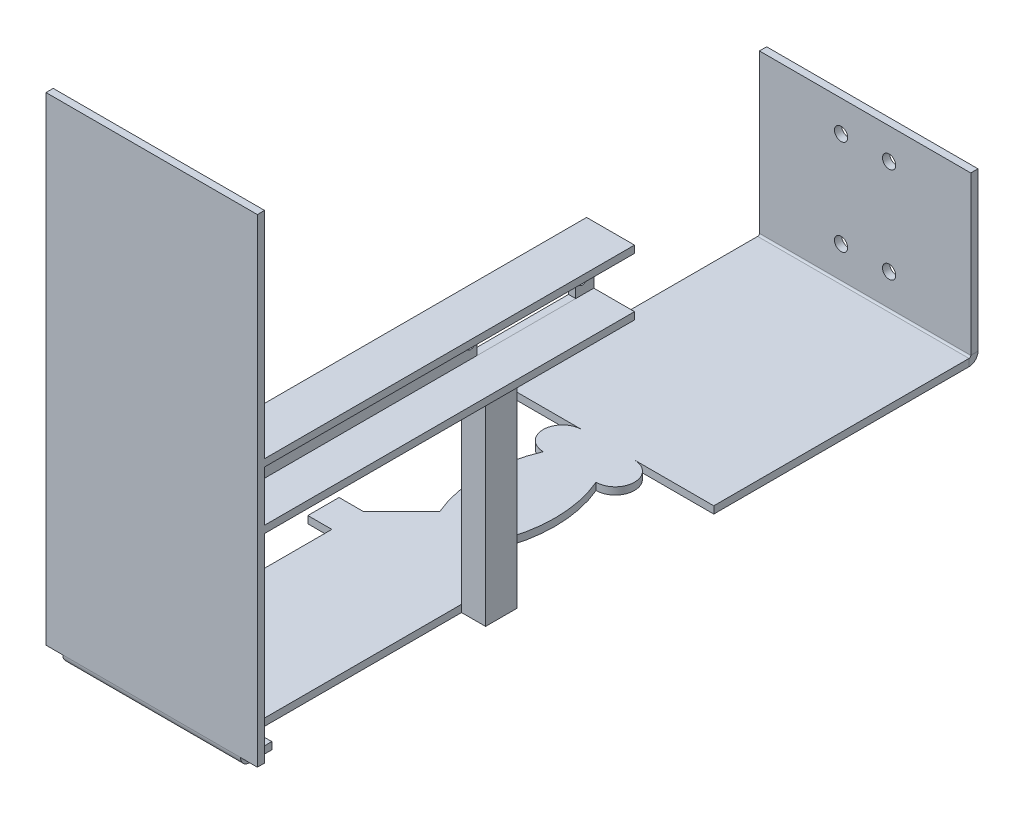
from build123d import *

# Parameters (mm, degrees)
BASE_FLANGE1_START                    = -3
BASE_FLANGE1_OUTLINE_W                = 88
BASE_FLANGE1_OUTLINE_H                = 300
BASE_FLANGE1_DEPTH                    = 3
CUT_EXTRUDE2_DEPTH                    = 509.426019398
CUT_EXTRUDE2_DEPTH_BACK               = 3
SKETCH14_OUTSIDE_W                    = 152.53
SKETCH14_OUTSIDE_H                    = 364.53
T_LE_PLI_E_SUR_AR_TE2_STRIP_W         = 13.4732
T_LE_PLI_E_SUR_AR_TE2_STRIP_H         = 3
T_LE_PLI_E_SUR_AR_TE2_STRIP_CUT_DEPTH = 88
T_LE_PLI_E_SUR_AR_TE2_DEPTH           = 88
D_GAGEMENT_M51_D                      = 5.5
T_LE_PLI_E_SUR_AR_TE3_STRIP_W         = 13.4732
T_LE_PLI_E_SUR_AR_TE3_STRIP_H         = 3
T_LE_PLI_E_SUR_AR_TE3_STRIP_CUT_DEPTH = 74
T_LE_PLI_E_SUR_AR_TE3_DEPTH           = 74
T_LE_PLI_E_SUR_AR_TE3_PROFILE_W       = 88
T_LE_PLI_E_SUR_AR_TE3_PROFILE_H       = 199.2634
T_LE_PLI_E_SUR_AR_TE3_FLAT_DEPTH      = 3
BOSS_EXTRUDE2_DEPTH                   = 154
CUT_EXTRUDE3_REACH                    = 544.8
SKETCH48_W                            = 41
SKETCH48_H                            = 21
BOSS_EXTRUDE3_REACH                   = 548.341
CUT_EXTRUDE4_REACH                    = 544.8
SKETCH50_R                            = 2


# Read off the part's stored shape, not the designer's step: Base-Flange1
# Sheet-metal steps are written as plain solids
with BuildPart() as part:
    # Base-Flange1 outline → Base-Flange1 (new body)
    with BuildSketch(Plane(origin=(0, 0, 0), x_dir=(1, 0, 0), z_dir=(0, 1, 0)).offset(BASE_FLANGE1_START)):
        with Locations((48.130435799, 350)):
            Rectangle(BASE_FLANGE1_OUTLINE_W, BASE_FLANGE1_OUTLINE_H)
    extrude(amount=BASE_FLANGE1_DEPTH)

    # Sketch14 outside → Cut-Extrude2 (cut, two sides: drawn at the far end of the back side and taken through both)
    with BuildSketch(Plane.XZ.offset(3).offset(-CUT_EXTRUDE2_DEPTH_BACK)):
        with Locations((48.13, -350)):
            Rectangle(SKETCH14_OUTSIDE_W, SKETCH14_OUTSIDE_H)
        with BuildLine():
            Line((85.130435799, -200), (11.130435799, -200))
            Line((11.130435799, -200), (11.130435799, -213))
            Line((11.130435799, -213), (21.130435799, -213))
            Line((21.130435799, -213), (21.130435799, -302))
            Line((21.130435799, -302), (11.130435799, -302))
            Line((11.130435799, -302), (11.130435799, -315))
            Line((11.130435799, -315), (21.130435799, -315))
            Line((21.130435799, -315), (37.130435799, -331))
            ThreePointArc((37.130435799, -331), (32.754046891, -352.5), (37.130435799, -374))
            ThreePointArc((37.130435799, -374), (29.130435799, -382), (37.130435799, -390))
            Line((37.130435799, -390), (4.130435799, -390))
            Line((4.130435799, -390), (4.130435799, -500))
            Line((4.130435799, -500), (92.130435799, -500))
            Line((92.130435799, -500), (92.130435799, -390))
            Line((92.130435799, -390), (59.130435799, -390))
            ThreePointArc((59.130435799, -390), (67.130435799, -382), (59.130435799, -374))
            ThreePointArc((59.130435799, -374), (63.506824707, -352.5), (59.130435799, -331))
            Line((59.130435799, -331), (75.130435799, -315))
            Line((75.130435799, -315), (85.130435799, -315))
            Line((85.130435799, -315), (85.130435799, -302))
            Line((85.130435799, -302), (75.130435799, -302))
            Line((75.130435799, -302), (75.130435799, -213))
            Line((75.130435799, -213), (85.130435799, -213))
            Line((85.130435799, -213), (85.130435799, -200))
        make_face(mode=Mode.SUBTRACT)
    extrude(amount=CUT_EXTRUDE2_DEPTH + CUT_EXTRUDE2_DEPTH_BACK, mode=Mode.SUBTRACT)

    # Tôle pliée sur arête2 strip (across the edge) → Tôle pliée sur arête2 strip cut (cut)
    with BuildSketch(Plane(origin=(92.130435799, 0, -500), x_dir=(0, 0, 1), z_dir=(-1, 0, 0))):
        with Locations((-3, -1.5)):
            Rectangle(T_LE_PLI_E_SUR_AR_TE2_STRIP_W, T_LE_PLI_E_SUR_AR_TE2_STRIP_H)
    extrude(amount=T_LE_PLI_E_SUR_AR_TE2_STRIP_CUT_DEPTH, mode=Mode.SUBTRACT)

    # Tôle pliée sur arête2 section (across the edge) → Tôle pliée sur arête2 (add)
    with BuildSketch(Plane(origin=(92.130435799, 0, -500), x_dir=(0, 0, 1), z_dir=(-1, 0, 0))):
        with BuildLine():
            Line((0, 0.7366), (0, 66.5))
            Line((0, 66.5), (3, 66.5))
            Line((3, 66.5), (3, 0.7366))
            ThreePointArc((3, 0.7366), (3.215745145, 0.215745145), (3.7366, 0))
            Line((3.7366, 0), (3.7366, -3))
            ThreePointArc((3.7366, -3), (1.094424801, -1.905575199), (0, 0.7366))
        make_face()
    extrude(amount=T_LE_PLI_E_SUR_AR_TE2_DEPTH)

    # Dégagement M51 (through all)
    with Locations(Plane(origin=(58.130435799, 53.6, -500), x_dir=(-1, 0, 0), z_dir=(0, 0, -1))):
        with Locations((0, 0), (20, 0), (0, -39.7), (20, -39.7)):
            Hole(D_GAGEMENT_M51_D / 2)

    # Tôle pliée sur arête3 strip (across the edge) → Tôle pliée sur arête3 strip cut (cut)
    with BuildSketch(Plane(origin=(11.130435799, 0, -200), x_dir=(0, 0, -1), z_dir=(1, 0, 0))):
        with Locations((-3, -1.5)):
            Rectangle(T_LE_PLI_E_SUR_AR_TE3_STRIP_W, T_LE_PLI_E_SUR_AR_TE3_STRIP_H)
    extrude(amount=T_LE_PLI_E_SUR_AR_TE3_STRIP_CUT_DEPTH, mode=Mode.SUBTRACT)

    # Tôle pliée sur arête3 bend section (across the edge) → Tôle pliée sur arête3 (add)
    with BuildSketch(Plane(origin=(11.130435799, 0, -200), x_dir=(0, 0, -1), z_dir=(1, 0, 0))):
        with BuildLine():
            Line((0, 0.7366), (3, 0.7366))
            ThreePointArc((3, 0.7366), (3.215745145, 0.215745145), (3.7366, 0))
            Line((3.7366, 0), (3.7366, -3))
            ThreePointArc((3.7366, -3), (1.094424801, -1.905575199), (0, 0.7366))
        make_face()
    extrude(amount=T_LE_PLI_E_SUR_AR_TE3_DEPTH)

    # Tôle pliée sur arête3 profile (on flange) → Tôle pliée sur arête3 flat (add)
    with BuildSketch(Plane(origin=(0, 0, -200), x_dir=(-1, 0, 0), z_dir=(0, 0, -1))):
        with Locations((-48.130435799, 100.3683)):
            Rectangle(T_LE_PLI_E_SUR_AR_TE3_PROFILE_W, T_LE_PLI_E_SUR_AR_TE3_PROFILE_H)
    extrude(amount=T_LE_PLI_E_SUR_AR_TE3_FLAT_DEPTH)

    # Sketch47 → Boss-Extrude2 (add)
    with BuildSketch(Plane(origin=(0, 0, -203), x_dir=(-1, 0, 0), z_dir=(0, 0, -1))):
        Polygon((-72.190435799, 83.5), (-72.190435799, 110.5), (-92.130435799, 110.5), (-92.130435799, 107.5), (-75.190435799, 107.5), (-75.190435799, 86.5), (-92.130435799, 86.5), (-92.130435799, 83.5), align=None)
    extrude(amount=BOSS_EXTRUDE2_DEPTH)

    # Sketch48 → Cut-Extrude3 (cut, up to next)
    with BuildSketch(Plane.ZY.offset(-72.190435799), mode=Mode.PRIVATE) as cut_extrude3_sk1:
        with Locations((-328.97, 97)):
            Rectangle(SKETCH48_W, SKETCH48_H)
    cut_extrude3_tool1 = extrude(cut_extrude3_sk1.sketch, amount=-CUT_EXTRUDE3_REACH, mode=Mode.PRIVATE) & part.part
    add(cut_extrude3_tool1.solids().sort_by_distance((72.190436, 97, -328.97))[0], mode=Mode.SUBTRACT)

    # Sketch49 → Boss-Extrude3 (add, up to next)
    with BuildSketch(Plane(origin=(0, 0, 0), x_dir=(1, 0, 0), z_dir=(0, 1, 0)), mode=Mode.PRIVATE) as boss_extrude3_sk1:
        Polygon((75.130435799, 315), (85.130435799, 315), (85.130435799, 302), (75.130435799, 302), (75.130435799, 304), (83.130435799, 304), (83.130435799, 313), (75.130435799, 313), align=None)
    boss_extrude3_tool1 = extrude(boss_extrude3_sk1.sketch, amount=BOSS_EXTRUDE3_REACH, mode=Mode.PRIVATE) - part.part
    add(boss_extrude3_tool1.solids().sort_by_distance((80.130436, 0, -314.835988))[0])

    # Sketch50 → Cut-Extrude4 (cut, up to next)
    with BuildSketch(Plane.ZY.offset(-72.190435799), mode=Mode.PRIVATE) as cut_extrude4_sk1:
        with Locations((-352.22, 102)):
            Circle(SKETCH50_R)
    cut_extrude4_tool1 = extrude(cut_extrude4_sk1.sketch, amount=-CUT_EXTRUDE4_REACH, mode=Mode.PRIVATE) & part.part
    # Sketch50 → Cut-Extrude4 (cut, up to next)
    with BuildSketch(Plane.ZY.offset(-72.190435799), mode=Mode.PRIVATE) as cut_extrude4_sk2:
        with Locations((-352.22, 92)):
            Circle(SKETCH50_R)
    cut_extrude4_tool2 = extrude(cut_extrude4_sk2.sketch, amount=-CUT_EXTRUDE4_REACH, mode=Mode.PRIVATE) & part.part
    # Sketch50 → Cut-Extrude4 (cut, up to next)
    with BuildSketch(Plane.ZY.offset(-72.190435799), mode=Mode.PRIVATE) as cut_extrude4_sk3:
        with Locations((-305.72, 102)):
            Circle(SKETCH50_R)
    cut_extrude4_tool3 = extrude(cut_extrude4_sk3.sketch, amount=-CUT_EXTRUDE4_REACH, mode=Mode.PRIVATE) & part.part
    # Sketch50 → Cut-Extrude4 (cut, up to next)
    with BuildSketch(Plane.ZY.offset(-72.190435799), mode=Mode.PRIVATE) as cut_extrude4_sk4:
        with Locations((-305.72, 92)):
            Circle(SKETCH50_R)
    cut_extrude4_tool4 = extrude(cut_extrude4_sk4.sketch, amount=-CUT_EXTRUDE4_REACH, mode=Mode.PRIVATE) & part.part
    add(cut_extrude4_tool1.solids().sort_by_distance((72.190436, 102, -352.22))[0], mode=Mode.SUBTRACT)
    add(cut_extrude4_tool2.solids().sort_by_distance((72.190436, 92, -352.22))[0], mode=Mode.SUBTRACT)
    add(cut_extrude4_tool3.solids().sort_by_distance((72.190436, 102, -305.72))[0], mode=Mode.SUBTRACT)
    add(cut_extrude4_tool4.solids().sort_by_distance((72.190436, 92, -305.72))[0], mode=Mode.SUBTRACT)


solid = part.part
